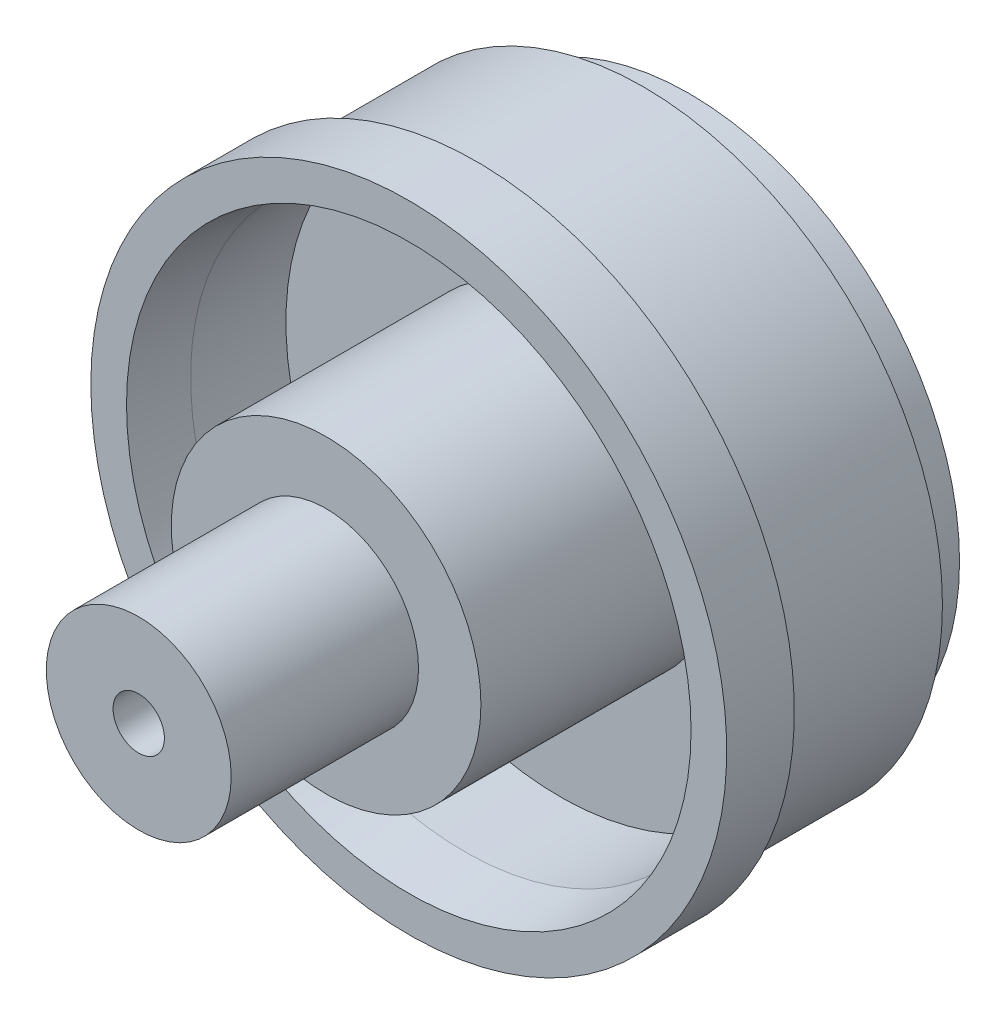
from build123d import *

# Parameters (mm, degrees)
SKETCH1_R         = 49.1363
EXTRUDE1_DEPTH    = 85.09
SKETCH5_R         = 3.96875
EXTRUDE5_DEPTH    = 26.67
SKETCH2_OUTSIDE_W = 132.864
SKETCH2_OUTSIDE_H = 132.864
SKETCH2_OUTSIDE_R = 14.2875
EXTRUDE2_DEPTH    = 28.956
SKETCH3_OUTSIDE_W = 132.864
SKETCH3_OUTSIDE_H = 132.864
SKETCH3_OUTSIDE_R = 23.9268
EXTRUDE3_DEPTH    = 12.7762
SKETCH4_OUTSIDE_W = 132.864
SKETCH4_OUTSIDE_H = 132.864
SKETCH4_OUTSIDE_R = 46.228
EXTRUDE4_DEPTH    = 32.9057
SKETCH6_R         = 42.3545
SKETCH6_R_2       = 23.9268
EXTRUDE8_DEPTH    = 23.368
SKETCH7_R         = 19.177
EXTRUDE9_DEPTH    = 50.8
SKETCH8_OUTSIDE_W = 132.864
SKETCH8_OUTSIDE_H = 132.864
SKETCH8_OUTSIDE_R = 41.7576
EXTRUDE10_DEPTH   = 7.112
CHAMFER1_SIZE     = 1.27
CHAMFER1_SIZE2    = 8.636


with BuildPart() as part:
    # Sketch1 → Extrude1 (new body)
    with BuildSketch(Plane.XY):
        Circle(SKETCH1_R)
    extrude(amount=EXTRUDE1_DEPTH)

    # Sketch5 → Extrude5 (cut)
    with BuildSketch(Plane.XY.offset(85.09)):
        Circle(SKETCH5_R)
    extrude(amount=-EXTRUDE5_DEPTH, mode=Mode.SUBTRACT)

    # Sketch2 outside → Extrude2 (cut)
    with BuildSketch(Plane.XY.offset(85.09)):
        Rectangle(SKETCH2_OUTSIDE_W, SKETCH2_OUTSIDE_H)
        Circle(SKETCH2_OUTSIDE_R, mode=Mode.SUBTRACT)
    extrude(amount=-EXTRUDE2_DEPTH, mode=Mode.SUBTRACT)

    # Sketch3 outside → Extrude3 (cut)
    with BuildSketch(Plane.XY.offset(56.134)):
        Rectangle(SKETCH3_OUTSIDE_W, SKETCH3_OUTSIDE_H)
        Circle(SKETCH3_OUTSIDE_R, mode=Mode.SUBTRACT)
    extrude(amount=-EXTRUDE3_DEPTH, mode=Mode.SUBTRACT)

    # Sketch4 outside → Extrude4 (cut)
    with BuildSketch(Plane(origin=(0, 0, 0), x_dir=(-1, 0, 0), z_dir=(0, 0, -1))):
        Rectangle(SKETCH4_OUTSIDE_W, SKETCH4_OUTSIDE_H)
        Circle(SKETCH4_OUTSIDE_R, mode=Mode.SUBTRACT)
    extrude(amount=-EXTRUDE4_DEPTH, mode=Mode.SUBTRACT)

    # Sketch6 → Extrude8 (cut)
    with BuildSketch(Plane.XY.offset(43.3578)):
        Circle(SKETCH6_R)
        Circle(SKETCH6_R_2, mode=Mode.SUBTRACT)
    extrude(amount=-EXTRUDE8_DEPTH, mode=Mode.SUBTRACT)

    # Sketch7 → Extrude9 (cut)
    with BuildSketch(Plane(origin=(0, 0, 0), x_dir=(-1, 0, 0), z_dir=(0, 0, -1))):
        Circle(SKETCH7_R)
    extrude(amount=-EXTRUDE9_DEPTH, mode=Mode.SUBTRACT)

    # Sketch8 outside → Extrude10 (cut)
    with BuildSketch(Plane(origin=(0, 0, 0), x_dir=(-1, 0, 0), z_dir=(0, 0, -1))):
        Rectangle(SKETCH8_OUTSIDE_W, SKETCH8_OUTSIDE_H)
        Circle(SKETCH8_OUTSIDE_R, mode=Mode.SUBTRACT)
    extrude(amount=-EXTRUDE10_DEPTH, mode=Mode.SUBTRACT)

    # Chamfer1
    chamfer1_edges = [part.edges().sort_by_distance(p)[0] for p in [
        (-42.3545, 0, 43.3578),
    ]]
    chamfer1_side = [part.faces().sort_by_distance(p)[0] for p in [
        (-47.746515563, 0, 43.3578),
    ]]
    chamfer(chamfer1_edges, length=CHAMFER1_SIZE, length2=CHAMFER1_SIZE2, reference=chamfer1_side[0])


solid = part.part
